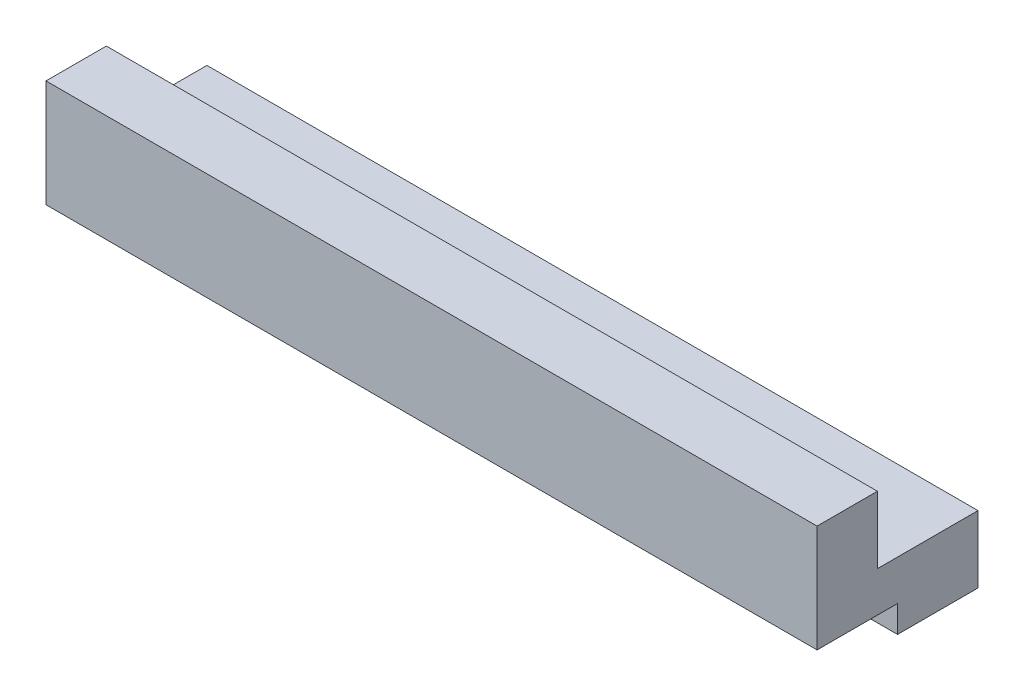
from build123d import *

# Parameters (mm, degrees)
SKETCH1_W           = 29.21
SKETCH1_H           = 2.286
BOSS_EXTRUDE1_DEPTH = 4.064
SKETCH3_W           = 29.21
SKETCH3_H           = 2.54
BOSS_EXTRUDE3_DEPTH = 3.81
SKETCH4_W           = 0.762
SKETCH4_H           = 1.016
CUT_EXTRUDE1_DEPTH  = 30.734


with BuildPart() as part:
    # Sketch1 → Boss-Extrude1 (new body)
    with BuildSketch(Plane(origin=(0, 0, 0), x_dir=(1, 0, 0), z_dir=(0, 1, 0))):
        with Locations((-4.291060606, 1.550939394)):
            Rectangle(SKETCH1_W, SKETCH1_H)
    extrude(amount=BOSS_EXTRUDE1_DEPTH)

    # Sketch3 → Boss-Extrude3 (add)
    with BuildSketch(Plane(origin=(0, 0, -2.693939394), x_dir=(-1, 0, 0), z_dir=(0, 0, -1))):
        with Locations((4.291060606, 0.254)):
            Rectangle(SKETCH3_W, SKETCH3_H)
    extrude(amount=BOSS_EXTRUDE3_DEPTH)

    # Sketch4 → Cut-Extrude1 (cut)
    with BuildSketch(Plane.ZY.offset(18.896060606)):
        with Locations((-3.074939394, -0.508)):
            Rectangle(SKETCH4_W, SKETCH4_H)
    extrude(amount=-CUT_EXTRUDE1_DEPTH, mode=Mode.SUBTRACT)


solid = part.part
